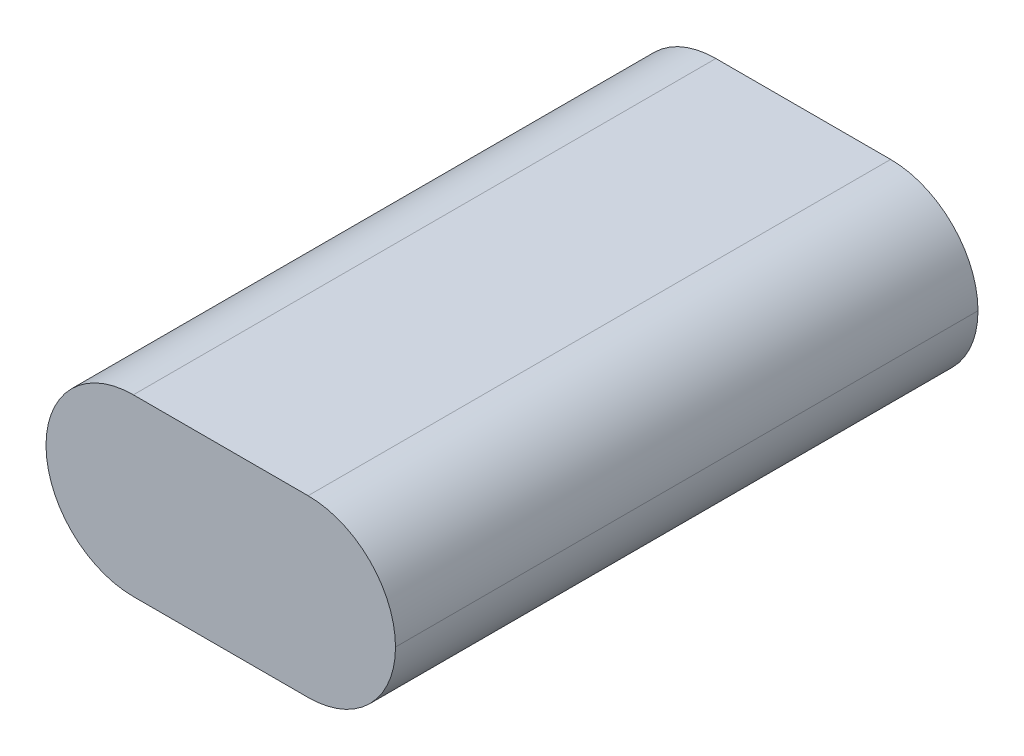
from build123d import *

# Parameters (mm, degrees)
SKETCH1_W           = 18
SKETCH1_H           = 30
BOSS_EXTRUDE1_DEPTH = 9
SKETCH2_W           = 12.5
SKETCH2_H           = 5.1
CUT_EXTRUDE1_DEPTH  = 10
FILLET1_R           = 4.5


with BuildPart() as part:
    # Sketch1 → Boss-Extrude1 (new body)
    with BuildSketch(Plane(origin=(0, 0, 0), x_dir=(1, 0, 0), z_dir=(0, 1, 0))):
        with Locations((9, 15)):
            Rectangle(SKETCH1_W, SKETCH1_H)
    extrude(amount=BOSS_EXTRUDE1_DEPTH)

    # Sketch2 → Cut-Extrude1 (cut)
    with BuildSketch(Plane(origin=(0, 0, -30), x_dir=(-1, 0, 0), z_dir=(0, 0, -1))):
        with Locations((-9, 4.5)):
            Rectangle(SKETCH2_W, SKETCH2_H)
    extrude(amount=-CUT_EXTRUDE1_DEPTH, mode=Mode.SUBTRACT)

    # Fillet1
    fillet1_edges = [part.edges().sort_by_distance(p)[0] for p in [
        (0, 0, -15),
        (0, 9, -15),
        (18, 0, -15),
        (18, 9, -15),
    ]]
    fillet(fillet1_edges, radius=FILLET1_R - 0.0001)  # a hair under: the kernel refuses the full size


solid = part.part
